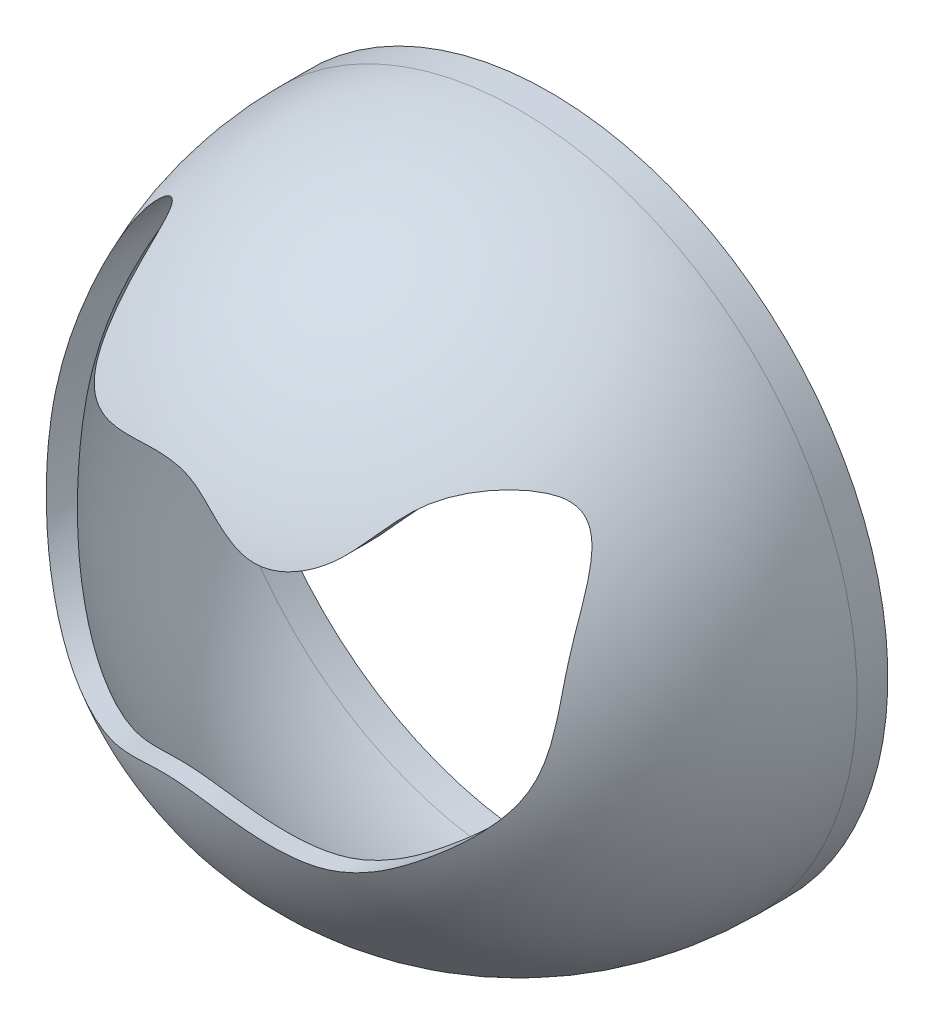
from build123d import *

# Parameters (mm, degrees)
SHELL1_T           = 3
CUT_EXTRUDE1_DEPTH = 70


with BuildPart() as part:
    # Sketch2 → Revolve1 (revolve)
    with BuildSketch(Plane(origin=(0, 0, 0), x_dir=(0, 0, -1), z_dir=(1, 0, 0))):
        with BuildLine():
            Line((90.580335522, 0), (147.580335522, 0))
            Line((147.580335522, 0), (147.580335522, 52))
            Line((147.580335522, 52), (142.580335522, 52))
            ThreePointArc((142.580335522, 52), (105.810782901, 36.769552622), (90.580335522, 0))
        make_face()
    revolve(axis=Axis((0, 0, -90.580335522), (0, 0, 1)))

    # Shell1
    shell1_openings = [part.faces().sort_by_distance(p)[0] for p in [
        (0, 0, -147.580335522),
    ]]
    offset(amount=SHELL1_T, openings=shell1_openings, kind=Kind.INTERSECTION)

    # Sketch9 → Cut-Extrude1 (cut)
    with BuildSketch(Plane(origin=(0, 0, -67.580335522), x_dir=(-1, 0, 0), z_dir=(0, 0, -1))):
        with BuildLine():
            add(Edge.make_bspline(
                [(32.08152705, 37.093339625), (29.875407214, 35.919884873), (32.540043496, 20.238702605), (15.878754888, 24.162119331), (4.211917657, 27.048360792), (-6.510640321, 18.068572966), (-18.334163971, 22.685102636), (-23.143372418, 32.685712127), (-39.656872885, 33.769943917), (-41.598020804, 14.134658163), (-41.966856155, -2.745013935), (-29.836762802, -13.863229699), (-17.204331652, -21.408271471), (-6.041287024, -16.095303441), (5.629436865, -13.148394284), (17.322096653, -19.524872929), (33.364707703, -17.582844966), (45.632859981, -4.588174107), (45.830037827, 14.030524463), (44.816132011, 28.023649596), (33.83318943, 38.025064417), (32.08152705, 37.093339625)],
                knots=[0, 0, 0, 0, 0.051096689, 0.094189698, 0.148467792, 0.194376249, 0.235839097, 0.274591804, 0.317068315, 0.383103687, 0.457294183, 0.510351498, 0.56525305, 0.613192383, 0.644405162, 0.701513446, 0.757417095, 0.819695958, 0.89008166, 0.959429154, 1, 1, 1, 1], degree=3))
        make_face()
    extrude(amount=CUT_EXTRUDE1_DEPTH, mode=Mode.SUBTRACT)


solid = part.part
